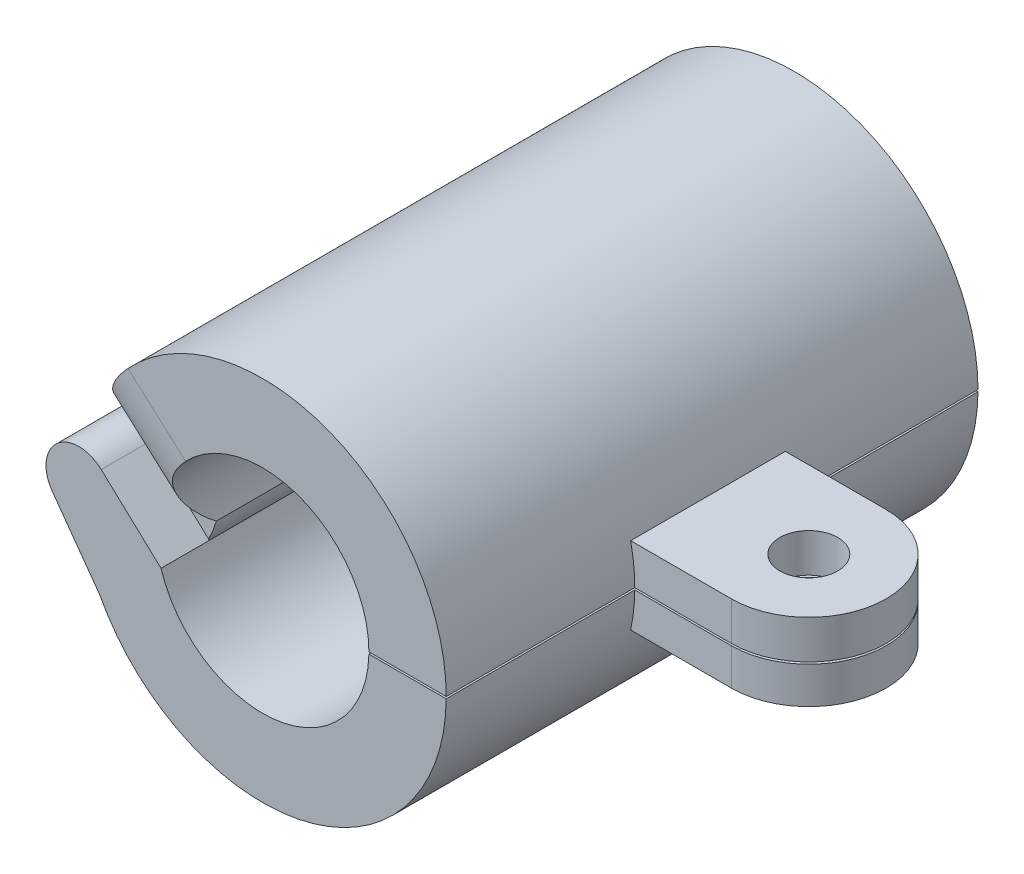
from build123d import *

# Parameters (mm, degrees)
SKETCH1_R                = 9.5
SKETCH1_R_2              = 5.5
BOSS_EXTRUDE1_DEPTH      = 13.75
CUT_EXTRUDE2_DEPTH       = 31.606371886
CUT_EXTRUDE3_DEPTH       = 31.606371886
BOSS_EXTRUDE3_DEPTH      = 27.5
BOSS_EXTRUDE4_DEPTH      = 13.75
BOSS_EXTRUDE4_DEPTH_BACK = 13.75
SKETCH8_R                = 1.7
BOSS_EXTRUDE5_DEPTH      = 2.5
CUT_EXTRUDE4_DEPTH       = 3
FILLET1_R                = 5
BOSS_EXTRUDE6_DEPTH      = 2
SKETCH13_W               = 13.523517167
SKETCH13_H               = 0.1
CUT_EXTRUDE5_DEPTH       = 28.3415893


with BuildPart() as part:
    # Sketch1 → Boss-Extrude1 (new, symmetric)
    with BuildSketch(Plane.XY):
        Circle(SKETCH1_R)
        Circle(SKETCH1_R_2, mode=Mode.SUBTRACT)
    extrude(amount=BOSS_EXTRUDE1_DEPTH, both=True)

    # Sketch3 → Cut-Extrude2 (cut, through all)
    with BuildSketch(Plane.XY.offset(13.75)):
        with BuildLine():
            ThreePointArc((5.5, 0), (5.499772704, -0.050002066), (5.499090834, -0.1))
            Line((5.499090834, -0.1), (9.49947367, -0.1))
            ThreePointArc((9.49947367, -0.1), (9.499868416, -0.050000693), (9.5, 0))
            Line((9.5, 0), (5.5, 0))
        make_face()
        with BuildLine():
            ThreePointArc((-8.410394737, -4.417607992), (-6.489683277, -3.411816705), (-5.2525, -1.631331894))
            ThreePointArc((-5.2525, -1.631331894), (-5.328919902, -1.361107153), (-5.391447368, -1.087334021))
            ThreePointArc((-5.391447368, -1.087334021), (-6.544982985, -3.054566162), (-8.549342105, -4.142312104))
            ThreePointArc((-8.549342105, -4.142312104), (-8.48098552, -4.28052387), (-8.410394737, -4.417607992))
        make_face()
    extrude(amount=-CUT_EXTRUDE2_DEPTH, mode=Mode.SUBTRACT)


with BuildPart() as cut_extrude2_piece_1:
    # of the separate pieces the step leaves, piece 1, a body of its own (cut_extrude2_pieces)
    add(part.part.solids().sort_by_distance((9.5, 0, -13.75))[0])

    # Sketch4 → Cut-Extrude3 (cut, through all)
    with BuildSketch(Plane.XY.offset(13.75)):
        with BuildLine():
            ThreePointArc((-9.299868421, 1.939702903), (-8.579652656, 1.719145359), (-7.996758373, 1.242080759))
            ThreePointArc((-7.996758373, 1.242080759), (-8.67137707, 2.877202726), (-8.3075, 4.608193111))
            ThreePointArc((-8.3075, 4.608193111), (-8.904216174, 3.311334221), (-9.299868421, 1.939702903))
        make_face()
        with BuildLine():
            ThreePointArc((-9.299868421, -1.939702903), (-8.052112473, -1.30618594), (-7.55, 0))
            ThreePointArc((-7.55, 0), (-7.665085673, 0.65999198), (-7.996758373, 1.242080759))
            ThreePointArc((-7.996758373, 1.242080759), (-8.579652656, 1.719145359), (-9.299868421, 1.939702903))
            ThreePointArc((-9.299868421, 1.939702903), (-9.5, 0), (-9.299868421, -1.939702903))
        make_face()
        with BuildLine():
            ThreePointArc((-9.299868421, 1.939702903), (-11.45, 0), (-9.299868421, -1.939702903))
            ThreePointArc((-9.299868421, -1.939702903), (-9.5, 0), (-9.299868421, 1.939702903))
        make_face()
    extrude(amount=-CUT_EXTRUDE3_DEPTH, mode=Mode.SUBTRACT)

    # Sketch5 → Boss-Extrude3 (add, through all)
    with BuildSketch(Plane.XY.offset(13.75)):
        with BuildLine():
            Line((-10.993786664, -1.253435839), (-12.755688883, -2.731847341))
            ThreePointArc((-12.755688883, -2.731847341), (-10.851164193, -4.029498148), (-8.549342105, -4.142312104))
            ThreePointArc((-8.549342105, -4.142312104), (-8.992299535, -3.064073934), (-9.299868421, -1.939702903))
            ThreePointArc((-9.299868421, -1.939702903), (-10.23220659, -1.807311127), (-10.993786664, -1.253435839))
        make_face()
        with BuildLine():
            ThreePointArc((-10.993786664, -1.253435839), (-12.613943525, -1.11169048), (-12.755688883, -2.731847341))
            Line((-12.755688883, -2.731847341), (-10.993786664, -1.253435839))
        make_face()
    extrude(amount=-BOSS_EXTRUDE3_DEPTH)

    # Sketch11 → Cut-Extrude4 (cut)
    with BuildSketch(Plane.XY.offset(13.75)):
        with BuildLine():
            Line((-7.996758373, 1.242080759), (-5.391447368, -1.087334021))
            ThreePointArc((-5.391447368, -1.087334021), (-8.57374401, -4.147836767), (-12.755688883, -2.731847341))
            ThreePointArc((-12.755688883, -2.731847341), (-12.613943525, -1.11169048), (-10.993786664, -1.253435839))
            ThreePointArc((-10.993786664, -1.253435839), (-8.252232745, -1.498524901), (-7.996758373, 1.242080759))
        make_face()
    cut_extrude4 = extrude(amount=-CUT_EXTRUDE4_DEPTH, mode=Mode.SUBTRACT)

    # Mirror2: Cut-Extrude4 across plane
    add(cut_extrude4.mirror(Plane.XY), mode=Mode.SUBTRACT)

    # Fillet1
    # the kernel refuses this fillet: 5 mm, written as the material it takes off along each edge
    with BuildSketch(Plane(origin=(-16.537262293, 8.878165672, 13.75), x_dir=(0.6665321357814128, 0.7454762987316689, 0), z_dir=(0.7454762987316689, -0.6665321357814128, 0))) as fillet1_piece_1:
        with BuildLine():
            CenterArc((4.582575695, -5), FILLET1_R, 90, 66.421821522)
            Line((0, -3), (0, 0))
            Line((0, 0), (4.582575695, 0))
        make_face()
    extrude(amount=26.407705888, mode=Mode.SUBTRACT)
    with BuildSketch(Plane(origin=(-16.537262293, 8.878165672, -13.75), x_dir=(0.6665321357814128, 0.7454762987316689, 0), z_dir=(0.7454762987316689, -0.6665321357814128, 0))) as fillet1_piece_2:
        with BuildLine():
            CenterArc((4.582575695, 5), FILLET1_R, 203.578178478, 66.421821522)
            Line((0, 3), (0, 0))
            Line((0, 0), (4.582575695, 0))
        make_face()
    extrude(amount=26.407705888, mode=Mode.SUBTRACT)



with BuildPart() as cut_extrude2_piece_2:
    # of the separate pieces the step leaves, piece 2, a body of its own (cut_extrude2_pieces)
    add(part.part.solids().sort_by_distance((-8.410394737, -4.417607992, -13.75))[0])



with BuildPart() as body_3:
    # Sketch8 → Boss-Extrude4 (new, two sides: drawn at the far end of the back side and taken through both)
    with BuildSketch(Plane.XY.offset(-BOSS_EXTRUDE4_DEPTH_BACK)):
        with Locations((-9.5, 0)):
            Circle(SKETCH8_R)
    extrude(amount=BOSS_EXTRUDE4_DEPTH + BOSS_EXTRUDE4_DEPTH_BACK)


with BuildPart() as cut_extrude2_piece_2_1:
    add(cut_extrude2_piece_2.part)

    add(body_3.part)  # Boss-Extrude5 merges body 3
    # Sketch9 → Boss-Extrude5 (add)
    with BuildSketch(Plane.XY.offset(13.75)):
        with BuildLine():
            Line((-8.410394737, -4.417607992), (-10.878896679, -0.994305762))
            ThreePointArc((-10.878896679, -0.994305762), (-8.375266279, -1.274744703), (-8.341695586, 1.244319446))
            Line((-8.341695586, 1.244319446), (-5.2525, -1.631331894))
            ThreePointArc((-5.2525, -1.631331894), (-6.489683277, -3.411816705), (-8.410394737, -4.417607992))
        make_face()
    boss_extrude5 = extrude(amount=-BOSS_EXTRUDE5_DEPTH)

    # Mirror1: Boss-Extrude5 across plane
    add(boss_extrude5.mirror(Plane.XY))


with BuildPart() as cut_extrude2_piece_1_1:
    add(cut_extrude2_piece_1.part)

    add(cut_extrude2_piece_2_1.part)  # Boss-Extrude6 merges Cut-Extrude2 piece 2
    # Sketch12 → Boss-Extrude6 (add, symmetric)
    with BuildSketch(Plane(origin=(0, 0, 0), x_dir=(1, 0, 0), z_dir=(0, 1, 0))):
        with BuildLine():
            Line((14.5, 4), (5.499090834, 4))
            Line((5.499090834, 4), (5.499090834, -4))
            Line((5.499090834, -4), (14.5, -4))
            ThreePointArc((14.5, -4), (18.5, 0), (14.5, 4))
        make_face()
    extrude(amount=BOSS_EXTRUDE6_DEPTH, both=True)

    # Sketch13 → Cut-Extrude5 (cut, through all)
    with BuildSketch(Plane.XY.offset(4)):
        with Locations((12.260849418, -0.05)):
            Rectangle(SKETCH13_W, SKETCH13_H)
    extrude(amount=-CUT_EXTRUDE5_DEPTH, mode=Mode.SUBTRACT)


with BuildPart() as cut_extrude5_piece_1:
    # of the separate pieces the step leaves, piece 1, a body of its own (cut_extrude5_pieces)
    add(cut_extrude2_piece_1_1.part.solids().sort_by_distance((9.5, 0, 4))[0])


with BuildPart() as cut_extrude5_piece_2:
    # of the separate pieces the step leaves, piece 2, a body of its own (cut_extrude5_pieces)
    add(cut_extrude2_piece_1_1.part.solids().sort_by_distance((-8.410394737, -4.417607992, -11.25))[0])


with BuildPart() as f_1_0mm_dowel_hole1_tool:
    # Sketch15 → Ø1.0mm Dowel Hole1 (revolve)
    with BuildSketch(Plane(origin=(14.5, 2, 0), x_dir=(0, 0, 1), z_dir=(1, 0, 0))):
        Polygon((0, 0), (0, 50), (1.5, 49.098709071), (1.5, 0), align=None)
    revolve(axis=Axis((14.5, 8.35, 0), (0, -1, 0)))


with BuildPart() as cut_extrude5_piece_1_1:
    add(cut_extrude5_piece_1.part)

    # Ø1.0mm Dowel Hole1: cut by f_1_0mm_dowel_hole1_tool
    add(f_1_0mm_dowel_hole1_tool.part, mode=Mode.SUBTRACT)


with BuildPart() as cut_extrude5_piece_2_1:
    add(cut_extrude5_piece_2.part)

    # Ø1.0mm Dowel Hole1: cut by f_1_0mm_dowel_hole1_tool
    add(f_1_0mm_dowel_hole1_tool.part, mode=Mode.SUBTRACT)


solid = Compound([cut_extrude5_piece_1_1.part, cut_extrude5_piece_2_1.part])
